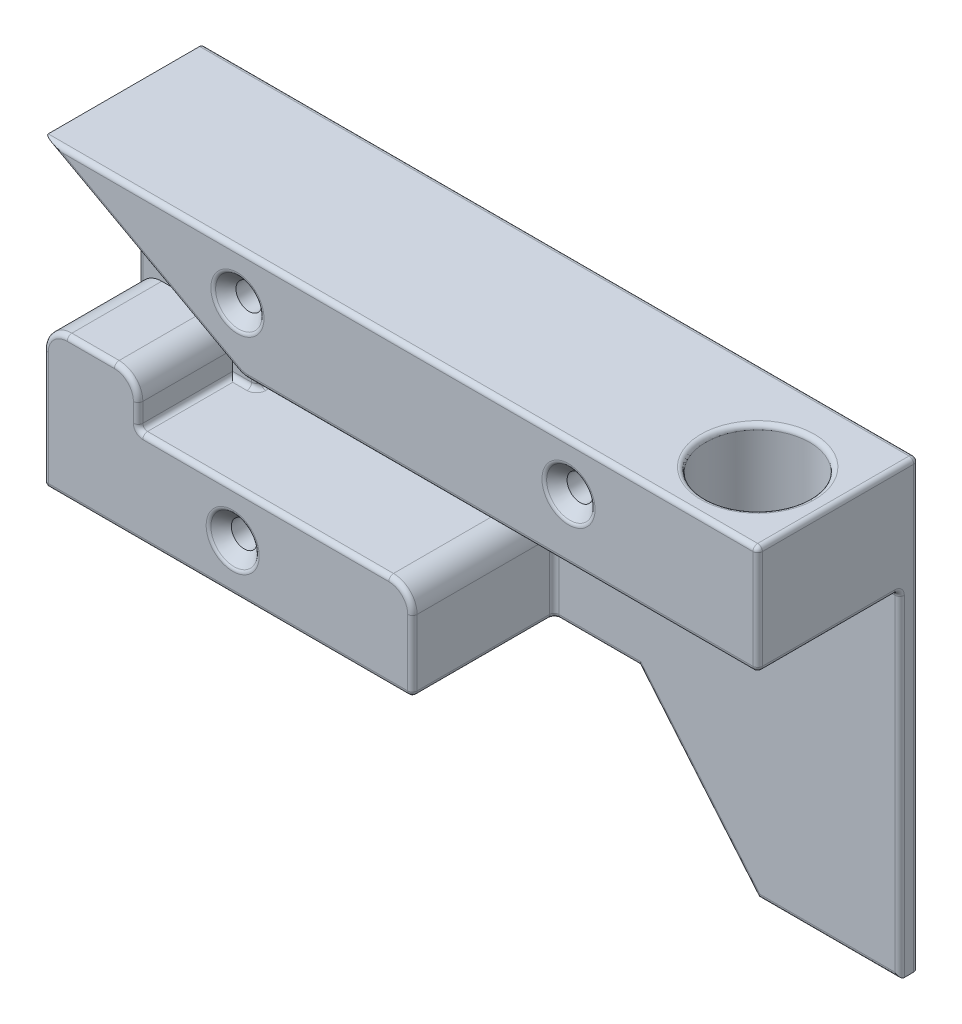
from build123d import *

# Parameters (mm, degrees)
BOSS_EXTRUDE1_DEPTH                                 = 4
BOSS_EXTRUDE2_DEPTH                                 = 30
BOSS_EXTRUDE3_DEPTH                                 = 10
BOSS_EXTRUDE4_DEPTH                                 = 5
FILLET1_R                                           = 5
CUT_EXTRUDE1_REACH                                  = 183.088
SKETCH5_R                                           = 11
CSK_FOR_M5_COUNTERSUNK_FLAT_HEAD_SCREW1_D           = 5.5
CSK_FOR_M5_COUNTERSUNK_FLAT_HEAD_SCREW1_DEPTH       = 24
CSK_FOR_M5_COUNTERSUNK_FLAT_HEAD_SCREW1_CSINK_D     = 10.4
CSK_FOR_M5_COUNTERSUNK_FLAT_HEAD_SCREW1_CSINK_ANGLE = 90
CSK_FOR_M5_COUNTERSUNK_FLAT_HEAD_SCREW1_TIP         = 1.652366702
FILLET3_R                                           = 1


with BuildPart() as part:
    # Sketch1 → Boss-Extrude1 (new body)
    with BuildSketch(Plane.XY):
        Polygon((95.827011065, 0), (121, -30), (151, -30), (151, 64), (0, 64), (0, 0), align=None)
    extrude(amount=BOSS_EXTRUDE1_DEPTH)

    # Sketch2 → Boss-Extrude2 (add)
    with BuildSketch(Plane.XY.offset(4)):
        Polygon((0, 64), (151, 64), (151, 41), (42, 41), align=None)
        Polygon((20, 20), (20, 30), (0, 30), (0, 0), (78, 0), (78, 20), align=None)
    extrude(amount=BOSS_EXTRUDE2_DEPTH)

    # Sketch3 → Boss-Extrude3 (add)
    with BuildSketch(Plane.XY.offset(4)):
        Polygon((25, 20), (25, 50.30952381), (0, 64), (0, 30), (20, 30), (20, 20), align=None)
    extrude(amount=BOSS_EXTRUDE3_DEPTH)

    # Sketch4 → Boss-Extrude4 (add)
    with BuildSketch(Plane.XY.offset(4)):
        Polygon((25, 50.30952381), (42, 41), (69, 41), (69, 20), (25, 20), align=None)
    extrude(amount=BOSS_EXTRUDE4_DEPTH)

    # Fillet1
    fillet1_edges = [part.edges().sort_by_distance(p)[0] for p in [
        (20, 30, 24),
        (78, 20, 19),
        (42, 41, 21.5),
        (0, 30, 24),
    ]]
    fillet(fillet1_edges, radius=FILLET1_R)

    # Sketch5 → Cut-Extrude1 (cut, up to next)
    with BuildSketch(Plane(origin=(0, 64, 0), x_dir=(1, 0, 0), z_dir=(0, 1, 0)), mode=Mode.PRIVATE) as cut_extrude1_sk1:
        with Locations((136, -19)):
            Circle(SKETCH5_R)
    cut_extrude1_tool1 = extrude(cut_extrude1_sk1.sketch, amount=-CUT_EXTRUDE1_REACH, mode=Mode.PRIVATE) & part.part
    add(cut_extrude1_tool1.solids().sort_by_distance((136, 64, 19))[0], mode=Mode.SUBTRACT)

    # CSK for M5 Countersunk Flat Head Screw1
    with Locations(Plane.XY.offset(34)):
        with Locations((41, 54), (111, 54), (40, 10)):
            CounterSinkHole(CSK_FOR_M5_COUNTERSUNK_FLAT_HEAD_SCREW1_D / 2, CSK_FOR_M5_COUNTERSUNK_FLAT_HEAD_SCREW1_CSINK_D / 2, depth=CSK_FOR_M5_COUNTERSUNK_FLAT_HEAD_SCREW1_DEPTH, counter_sink_angle=CSK_FOR_M5_COUNTERSUNK_FLAT_HEAD_SCREW1_CSINK_ANGLE)
            with Locations((0, 0, -(CSK_FOR_M5_COUNTERSUNK_FLAT_HEAD_SCREW1_DEPTH + CSK_FOR_M5_COUNTERSUNK_FLAT_HEAD_SCREW1_TIP / 2))):  # 118° drill point
                Cone(0, CSK_FOR_M5_COUNTERSUNK_FLAT_HEAD_SCREW1_D / 2, CSK_FOR_M5_COUNTERSUNK_FLAT_HEAD_SCREW1_TIP, mode=Mode.SUBTRACT)

    # Fillet3
    fillet3_edges = [part.edges().sort_by_distance(p)[0] for p in [
        (151, 41, 19),
        (20, 20, 24),
        (22.5, 20, 14),
        (25, 20, 11.5),
        (32.938917744, 45.962021235, 9),
        (42.039934258, 41.156065303, 9),
        (56.139704302, 41, 9),
        (47, 20, 9),
        (25, 35.154761905, 9),
        (110, 41, 4),
        (151, 5.5, 4),
        (136, -30, 4),
        (108.413505532, -15, 4),
        (86.913505532, 0, 4),
        (76.535533906, 18.535533906, 4),
        (71, 20, 4),
        (69, 20, 6.5),
        (69, 30.5, 9),
        (69, 41, 6.5),
        (69, 30.5, 4),
        (75.5, 64, 34),
        (151, 52.5, 34),
        (97.139704302, 41, 34),
        (42.039934258, 41.156065303, 34),
        (20.438917744, 52.80725933, 34),
        (116.2, 54, 34),
        (46.2, 54, 34),
        (39, 0, 34),
        (0, 12.5, 34),
        (1.464466094, 28.535533906, 34),
        (10, 30, 34),
        (18.535533906, 28.535533906, 34),
        (20, 22.5, 34),
        (46.5, 20, 34),
        (76.535533906, 18.535533906, 34),
        (45.2, 10, 34),
        (78, 0, 19),
        (78, 7.5, 34),
        (78, 7.5, 4),
        (47.913505532, 0, 0),
        (108.413505532, -15, 0),
        (136, -30, 0),
        (151, 17, 0),
        (75.5, 64, 0),
        (0, 32, 0),
        (0, 0, 17),
        (125, 41, 19),
        (125, 64, 19),
        (151, 64, 17),
        (0, 44.5, 14),
        (25, 35.154761905, 14),
        (40, 12.75, 10),
    ]]
    fillet(fillet3_edges, radius=FILLET3_R)


solid = part.part
